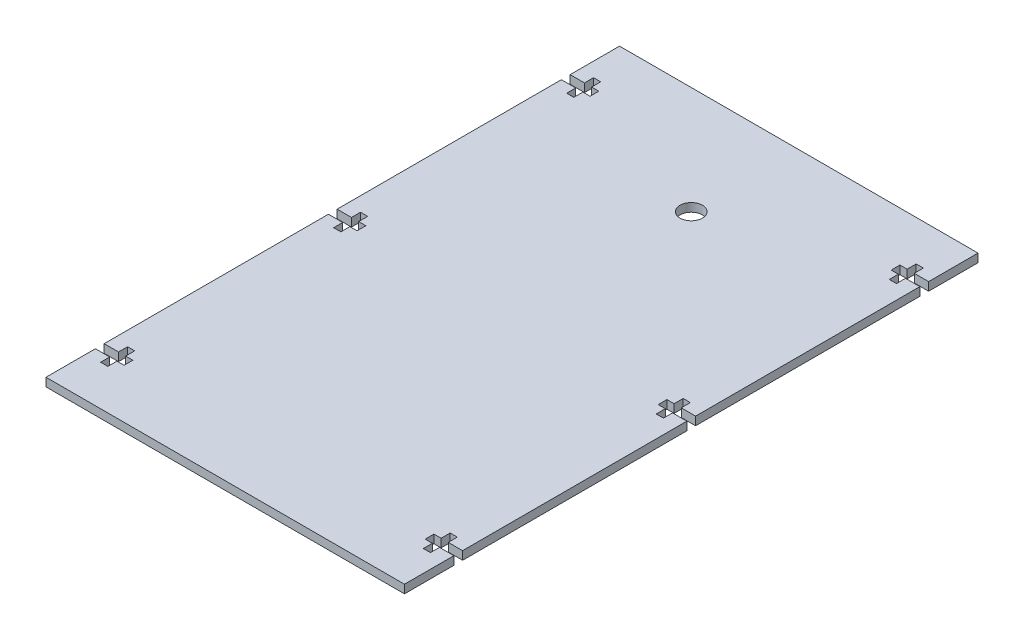
from build123d import *

# Parameters (mm, degrees)
SKETCH1_R           = 3.96875
BOSS_EXTRUDE1_DEPTH = 2.9718


with BuildPart() as part:
    # Sketch1 → Boss-Extrude1 (new body)
    with BuildSketch(Plane(origin=(0, 0, 0), x_dir=(1, 0, 0), z_dir=(0, 1, 0))):
        Polygon((0, 16.289115604), (0, 0), (127, 0), (127, 16.289115604), (127, 17.5006), (121.92, 17.5006), (121.92, 14.2875), (119.38, 14.2875), (119.38, 17.5006), (116.84, 17.5006), (116.84, 20.5994), (119.38, 20.5994), (119.38, 23.8125), (121.92, 23.8125), (121.92, 20.5994), (127, 20.5994), (127, 21.240412098), (127, 100.0506), (121.92, 100.0506), (121.92, 96.8375), (119.38, 96.8375), (119.38, 100.0506), (116.84, 100.0506), (116.84, 103.1494), (119.38, 103.1494), (119.38, 106.3625), (121.92, 106.3625), (121.92, 103.1494), (127, 103.1494), (127, 182.6006), (121.92, 182.6006), (121.92, 179.3875), (119.38, 179.3875), (119.38, 182.6006), (116.84, 182.6006), (116.84, 185.6994), (119.38, 185.6994), (119.38, 188.9125), (121.92, 188.9125), (121.92, 185.6994), (127, 185.6994), (127, 203.2), (0, 203.2), (0, 185.6994), (5.08, 185.6994), (5.08, 188.9125), (7.62, 188.9125), (7.62, 185.6994), (10.16, 185.6994), (10.16, 182.6006), (7.62, 182.6006), (7.62, 179.3875), (5.08, 179.3875), (5.08, 182.6006), (0, 182.6006), (0, 103.1494), (5.08, 103.1494), (5.08, 106.3625), (7.62, 106.3625), (7.62, 103.1494), (10.16, 103.1494), (10.16, 100.0506), (7.62, 100.0506), (7.62, 96.8375), (5.08, 96.8375), (5.08, 100.0506), (0, 100.0506), (0, 21.240412098), (0, 20.5994), (5.08, 20.5994), (5.08, 23.8125), (7.62, 23.8125), (7.62, 20.5994), (10.16, 20.5994), (10.16, 17.5006), (7.62, 17.5006), (7.62, 14.2875), (5.08, 14.2875), (5.08, 17.5006), (0, 17.5006), align=None)
        with Locations((63.5, 165.1)):
            Circle(SKETCH1_R, mode=Mode.SUBTRACT)
    extrude(amount=BOSS_EXTRUDE1_DEPTH)


solid = part.part
